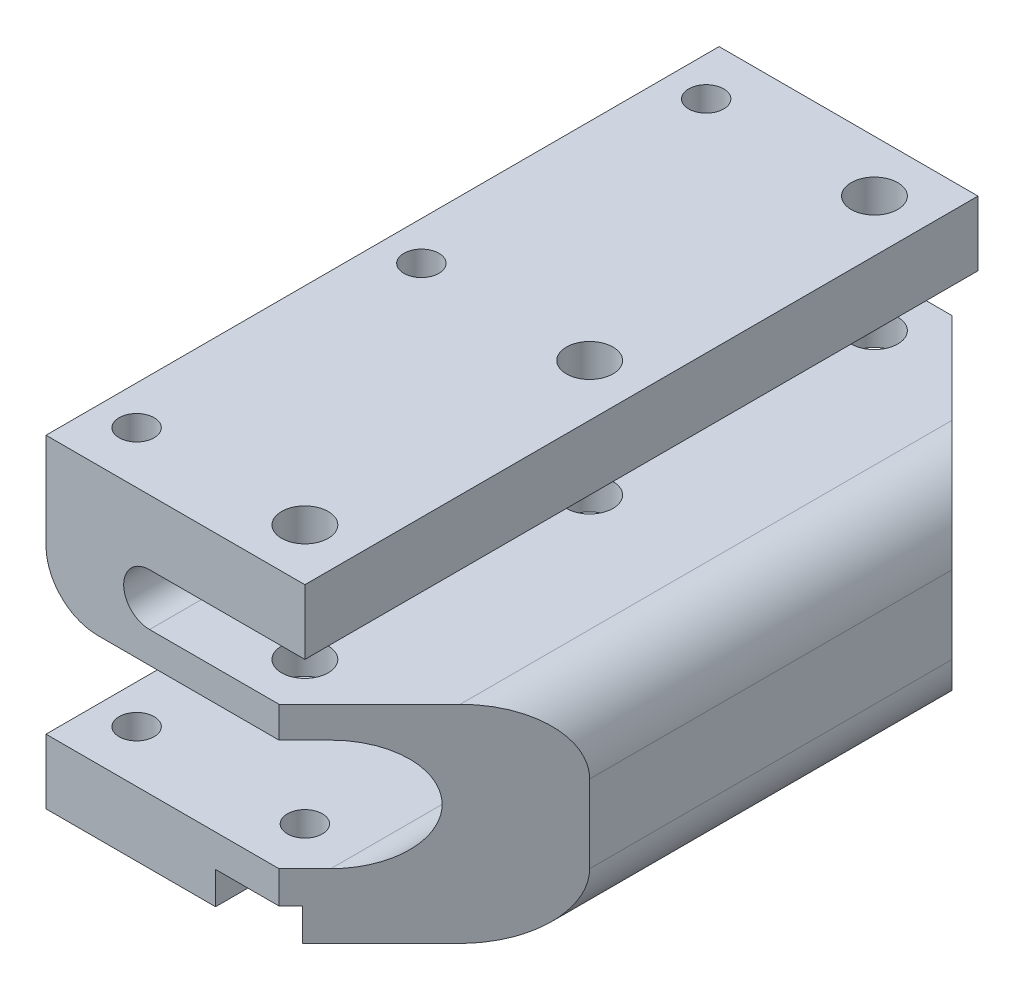
from build123d import *

# Parameters (mm, degrees)
BOSS_EXTRUDE1_DEPTH = 52
CUT_EXTRUDE1_REACH  = 67.031
SKETCH2_R           = 1.8
CUT_EXTRUDE3_REACH  = 67.031
SKETCH4_R           = 1.35
CUT_EXTRUDE4_REACH  = 67.031
SKETCH5_R           = 1.35
SKETCH6_R           = 1.35
CUT_EXTRUDE5_DEPTH  = 64.277168192
CHAMFER3_SIZE       = 12
LPATTERN3_COUNT     = 2
LPATTERN3_PITCH     = 22
LPATTERN3_COL_COUNT = 2
LPATTERN3_COL_PITCH = 22
SKETCH7_W           = 5.8
SKETCH7_H           = 12
SKETCH7_H_2         = 12.747013555
SKETCH7_H_3         = 13.058470869
CUT_EXTRUDE6_DEPTH  = 2.5
CHAMFER4_SIZE       = 2.5


# Some blends are built 0.0001 mm under size
with BuildPart() as part:
    # Sketch1 → Boss-Extrude1 (new body)
    with BuildSketch(Plane.XY):
        with BuildLine():
            Line((0, 0), (25, 0))
            ThreePointArc((25, 0), (28.535533906, 1.464466094), (30, 5))
            Line((30, 5), (30, 11))
            ThreePointArc((30, 11), (28.535533906, 14.535533906), (25, 16))
            Line((25, 16), (8, 16))
            ThreePointArc((8, 16), (6, 18), (8, 20))
            Line((8, 20), (20, 20))
            Line((20, 20), (20, 25))
            Line((20, 25), (0, 25))
            Line((0, 25), (0, 17.6))
            ThreePointArc((0, 17.6), (1.171572875, 14.771572875), (4, 13.6))
            Line((4, 13.6), (20, 13.6))
            ThreePointArc((20, 13.6), (24.3, 9.3), (20, 5))
            Line((20, 5), (0, 5))
            Line((0, 5), (0, 0))
        make_face()
    extrude(amount=BOSS_EXTRUDE1_DEPTH)

    # Cut-Extrude1: up to this face of the body (flat: up to its plane)
    cut_extrude1_end = Plane(part.part.faces().sort_by_distance((12, 13.6, 26))[0])
    # Sketch2 → Cut-Extrude1 (cut, up to the picked face)
    with BuildSketch(Plane(origin=(0, 25, 0), x_dir=(1, 0, 0), z_dir=(0, 1, 0)), mode=Mode.PRIVATE) as cut_extrude1_sk1:
        with Locations(Location((16, -26, 0), (0, 0, 270))):
            Circle(SKETCH2_R)
    cut_extrude1_tool1 = split(extrude(cut_extrude1_sk1.sketch, amount=-CUT_EXTRUDE1_REACH, mode=Mode.PRIVATE), bisect_by=cut_extrude1_end, keep=Keep.BOTH, mode=Mode.PRIVATE)
    cut_extrude1 = cut_extrude1_tool1.solids().sort_by(Axis((16, 25, 26), (0, -1, 0)))[0]
    add(cut_extrude1, mode=Mode.SUBTRACT)

    # Sketch4 → Cut-Extrude3 (cut, up to next)
    with BuildSketch(Plane(origin=(0, 25, 0), x_dir=(1, 0, 0), z_dir=(0, 1, 0)), mode=Mode.PRIVATE) as cut_extrude3_sk1:
        with Locations(Location((3, -26, 0), (0, 0, 270))):
            Circle(SKETCH4_R)
    cut_extrude3_tool1 = extrude(cut_extrude3_sk1.sketch, amount=-CUT_EXTRUDE3_REACH, mode=Mode.PRIVATE) & part.part
    cut_extrude3 = cut_extrude3_tool1.solids().sort_by_distance((3, 25, 26))[0]
    add(cut_extrude3, mode=Mode.SUBTRACT)

    # Sketch5 → Cut-Extrude4 (cut, up to next)
    with BuildSketch(Plane.XZ, mode=Mode.PRIVATE) as cut_extrude4_sk1:
        with Locations(Location((3, 26, 0), (0, 0, 90))):
            Circle(SKETCH5_R)
    cut_extrude4_tool1 = extrude(cut_extrude4_sk1.sketch, amount=-CUT_EXTRUDE4_REACH, mode=Mode.PRIVATE) & part.part
    cut_extrude4 = cut_extrude4_tool1.solids().sort_by_distance((3, 0, 26))[0]
    add(cut_extrude4, mode=Mode.SUBTRACT)

    # Sketch6 → Cut-Extrude5 (cut, through all)
    with BuildSketch(Plane(origin=(0, 5, 0), x_dir=(1, 0, 0), z_dir=(0, 1, 0))):
        with Locations(Location((16, -26, 0), (0, 0, 180))):
            Circle(SKETCH6_R)
    cut_extrude5 = extrude(amount=-CUT_EXTRUDE5_DEPTH, mode=Mode.SUBTRACT)

    # Chamfer3
    # the kernel refuses this chamfer: 12 mm, written as the material it takes off along each edge
    with BuildSketch(Plane(origin=(30, -25.860195856, 0), x_dir=(-0.9996219169112969, 0, -0.027495876610586372), z_dir=(0, 1, 0))) as chamfer3_piece_1_section:
        Polygon((CHAMFER3_SIZE * 0.999621916911, CHAMFER3_SIZE * 0.0274958766106), (-CHAMFER3_SIZE * 0.0274958766106, CHAMFER3_SIZE * 0.999621916911), (0, 0), align=None)
    chamfer3_piece_1 = extrude(amount=67.720391711, mode=Mode.PRIVATE)
    chamfer3_piece_1 = split(chamfer3_piece_1, bisect_by=Plane(origin=(19.333333334, 20, 0.666666666), z_dir=(0, -1, 0)), keep=Keep.TOP, mode=Mode.PRIVATE)
    add(chamfer3_piece_1, mode=Mode.SUBTRACT)
    with BuildSketch(Plane(origin=(30, -25.860195856, 52), x_dir=(-0.9996219169112969, 0, 0.027495876610586202), z_dir=(0, 1, 0))) as chamfer3_piece_2_section:
        Polygon((CHAMFER3_SIZE * 0.999621916911, -CHAMFER3_SIZE * 0.0274958766106), (-CHAMFER3_SIZE * 0.0274958766106, -CHAMFER3_SIZE * 0.999621916911), (0, 0), align=None)
    chamfer3_piece_2 = extrude(amount=67.720391711, mode=Mode.PRIVATE)
    chamfer3_piece_2 = split(chamfer3_piece_2, bisect_by=Plane(origin=(19.333333334, 20, 51.333333333), z_dir=(0, -1, 0)), keep=Keep.TOP, mode=Mode.PRIVATE)
    add(chamfer3_piece_2, mode=Mode.SUBTRACT)

    # LPattern3: Cut-Extrude1, Cut-Extrude3, Cut-Extrude4, Cut-Extrude5 ×2
    with Locations(*[(0, 0, i * LPATTERN3_PITCH) for i in range(1, LPATTERN3_COUNT)]):
        add(cut_extrude1, mode=Mode.SUBTRACT)
        add(cut_extrude3, mode=Mode.SUBTRACT)
        add(cut_extrude4, mode=Mode.SUBTRACT)
        add(cut_extrude5, mode=Mode.SUBTRACT)

    # LPattern3 col: Cut-Extrude1, Cut-Extrude3, Cut-Extrude4, Cut-Extrude5 ×2
    with Locations(*[(0, 0, -i * LPATTERN3_COL_PITCH) for i in range(1, LPATTERN3_COL_COUNT)]):
        add(cut_extrude1, mode=Mode.SUBTRACT)
        add(cut_extrude3, mode=Mode.SUBTRACT)
        add(cut_extrude4, mode=Mode.SUBTRACT)
        add(cut_extrude5, mode=Mode.SUBTRACT)

    # Sketch7 → Cut-Extrude6 (cut)
    with BuildSketch(Plane.XZ):
        with Locations((16, 26)):
            Rectangle(SKETCH7_W, SKETCH7_H)
        with Locations((16, 4.626493222)):
            Rectangle(SKETCH7_W, SKETCH7_H_2)
        with Locations((16, 47.529235435)):
            Rectangle(SKETCH7_W, SKETCH7_H_3)
    extrude(amount=-CUT_EXTRUDE6_DEPTH, mode=Mode.SUBTRACT)

    # Chamfer4
    chamfer4_edges = [part.edges().sort_by_distance(p)[0] for p in [
        (16, 2.5, 41),
        (16, 2.5, 20),
        (16, 2.5, 32),
        (16, 2.5, 11),
    ]]
    chamfer(chamfer4_edges, length=CHAMFER4_SIZE - 0.0001)  # a hair under: the kernel refuses the full size


solid = part.part
